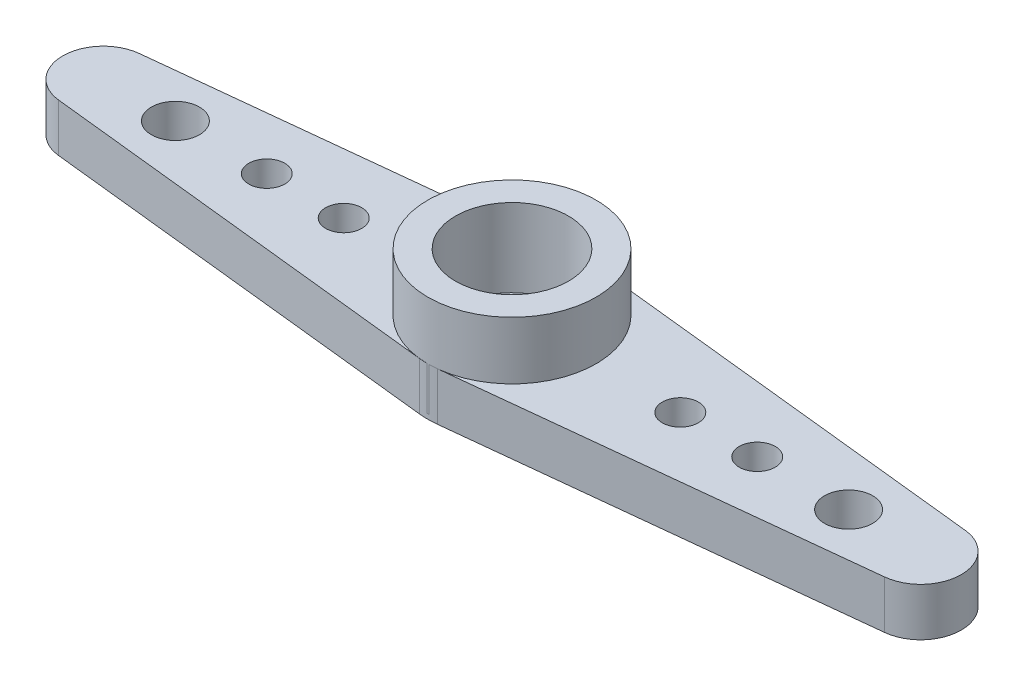
from build123d import *

# Parameters (mm, degrees)
BOSS_EXTRUDE1_START = -0.2
SKETCH1_R           = 3.5
SKETCH1_R_2         = 1.5
BOSS_EXTRUDE1_DEPTH = 4.2
BOSS_EXTRUDE2_START = 0.2
SKETCH2_R           = 1.5
SKETCH2_R_2         = 1
BOSS_EXTRUDE2_DEPTH = 2
SKETCH3_R           = 2.35
CUT_EXTRUDE1_DEPTH  = 3.25
SKETCH5_R           = 0.75
CUT_EXTRUDE2_DEPTH  = 20.514430915


with BuildPart() as part:
    # Sketch1 → Boss-Extrude1 (new body)
    with BuildSketch(Plane(origin=(0, 0, 0), x_dir=(1, 0, 0), z_dir=(0, 1, 0)).offset(BOSS_EXTRUDE1_START)):
        Circle(SKETCH1_R)
        Circle(SKETCH1_R_2, mode=Mode.SUBTRACT)
    extrude(amount=BOSS_EXTRUDE1_DEPTH)


with BuildPart() as body_2:
    # Sketch2 → Boss-Extrude2 (new body)
    with BuildSketch(Plane.XZ.offset(0.2).offset(BOSS_EXTRUDE2_START)):
        with BuildLine():
            Line((-0.373269967, 3.480038726), (-17.179913399, 1.677353257))
            ThreePointArc((-17.179913399, 1.677353257), (-18.686974415, -0.000324638), (-17.179267812, -1.677422377))
            Line((-17.179267812, -1.677422377), (-0.583333333, -3.45104654))
            ThreePointArc((-0.583333333, -3.45104654), (0, -3.5), (0.583333333, -3.45104654))
            Line((0.583333333, -3.45104654), (17.179267812, -1.677422377))
            ThreePointArc((17.179267812, -1.677422377), (18.686974415, -0.000324638), (17.179913399, 1.677353257))
            Line((17.179913399, 1.677353257), (0.373269967, 3.480038726))
            ThreePointArc((0.373269967, 3.480038726), (0, 3.5), (-0.373269967, 3.480038726))
        make_face()
        Circle(SKETCH2_R, mode=Mode.SUBTRACT)
        with Locations((14, 0)):
            Circle(SKETCH2_R_2, mode=Mode.SUBTRACT)
        with Locations((-14, 0)):
            Circle(SKETCH2_R_2, mode=Mode.SUBTRACT)
    extrude(amount=-BOSS_EXTRUDE2_DEPTH)


with BuildPart() as cut_extrude1_tool:
    # Sketch3 → Cut-Extrude1 (new body)
    with BuildSketch(Plane(origin=(0, 4, 0), x_dir=(1, 0, 0), z_dir=(0, 1, 0))):
        Circle(SKETCH3_R)
    extrude(amount=-CUT_EXTRUDE1_DEPTH)


with BuildPart() as part_1:
    add(part.part)

    # Cut-Extrude1: cut by cut_extrude1_tool
    add(cut_extrude1_tool.part, mode=Mode.SUBTRACT)


with BuildPart() as body_2_1:
    add(body_2.part)

    # Cut-Extrude1: cut by cut_extrude1_tool
    add(cut_extrude1_tool.part, mode=Mode.SUBTRACT)

    # Sketch5 → Cut-Extrude2 (cut, through all)
    with BuildSketch(Plane.XZ.offset(0.4)):
        with Locations((10.2, 0)):
            Circle(SKETCH5_R)
        with Locations((7, 0)):
            Circle(SKETCH5_R)
        with Locations((-7, 0)):
            Circle(SKETCH5_R)
        with Locations((-10.2, 0)):
            Circle(SKETCH5_R)
    extrude(amount=-CUT_EXTRUDE2_DEPTH, mode=Mode.SUBTRACT)


solid = Compound([part_1.part, body_2_1.part])
